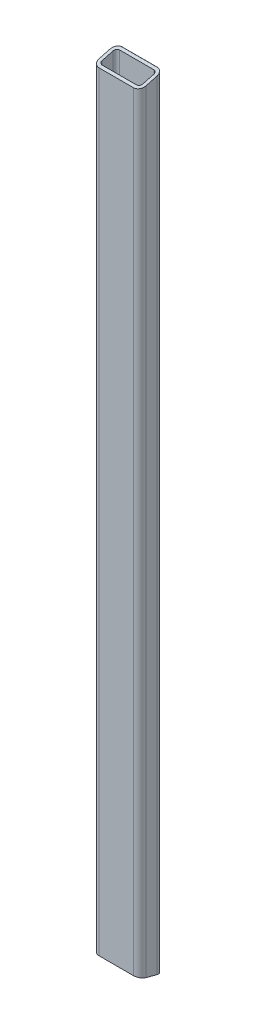
from build123d import *

# Parameters (mm, degrees)
EXTRUDE_1_DEPTH      = 250
EXTRUDE_1_DEPTH_BACK = 250
CHAMFER_1_SIZE       = 4
CHAMFER_1_SIZE_2     = 14.92820323


with BuildPart() as part:
    # Эскиз1 → Вытянуть-Тонкостенный1 (new, two sides: drawn at the far end of the back side and taken through both)
    with BuildSketch(Plane(origin=(0, 0, 0), x_dir=(1, 0, 0), z_dir=(0, 1, 0)).offset(-EXTRUDE_1_DEPTH_BACK)):
        with BuildLine():
            Line((-11, 7.5), (11, 7.5))
            ThreePointArc((11, 7.5), (13.828427125, 6.328427125), (15, 3.5))
            Line((15, 3.5), (15, -3.5))
            ThreePointArc((15, -3.5), (13.828427125, -6.328427125), (11, -7.5))
            Line((11, -7.5), (-11, -7.5))
            ThreePointArc((-11, -7.5), (-13.828427125, -6.328427125), (-15, -3.5))
            Line((-15, -3.5), (-15, 3.5))
            ThreePointArc((-15, 3.5), (-13.828427125, 6.328427125), (-11, 7.5))
        make_face()
        with BuildLine():
            Line((-11, 5.5), (11, 5.5))
            ThreePointArc((11, 5.5), (12.414213562, 4.914213562), (13, 3.5))
            Line((13, 3.5), (13, -3.5))
            ThreePointArc((13, -3.5), (12.414213562, -4.914213562), (11, -5.5))
            Line((11, -5.5), (-11, -5.5))
            ThreePointArc((-11, -5.5), (-12.414213562, -4.914213562), (-13, -3.5))
            Line((-13, -3.5), (-13, 3.5))
            ThreePointArc((-13, 3.5), (-12.414213562, 4.914213562), (-11, 5.5))
        make_face(mode=Mode.SUBTRACT)
    extrude(amount=EXTRUDE_1_DEPTH + EXTRUDE_1_DEPTH_BACK)

    # Фаска1
    # the kernel refuses this chamfer: 14.92820323, 4 mm, written as the material it takes off along each edge
    with BuildSketch(Plane(origin=(49.764387332, -250, 7.5), x_dir=(0, 0.9905000388259542, 0.13751244702129073), z_dir=(-1, 0, 0))) as chamfer_1_piece_1:
        Polygon((CHAMFER_1_SIZE * 0.990500038826, CHAMFER_1_SIZE * 0.137512447021), (-CHAMFER_1_SIZE_2 * 0.137512447024, CHAMFER_1_SIZE_2 * 0.990500038844), (0, 0), align=None)
    extrude(amount=99.528774665, mode=Mode.SUBTRACT)
    with BuildSketch(Plane(origin=(49.764387332, 250, 7.5), x_dir=(0, -0.9905000388259542, 0.13751244702129073), z_dir=(-1, 0, 0))) as chamfer_1_piece_2:
        Polygon((CHAMFER_1_SIZE * 0.990500038826, -CHAMFER_1_SIZE * 0.137512447021), (-CHAMFER_1_SIZE_2 * 0.137512447024, -CHAMFER_1_SIZE_2 * 0.990500038844), (0, 0), align=None)
    extrude(amount=99.528774665, mode=Mode.SUBTRACT)


solid = part.part
